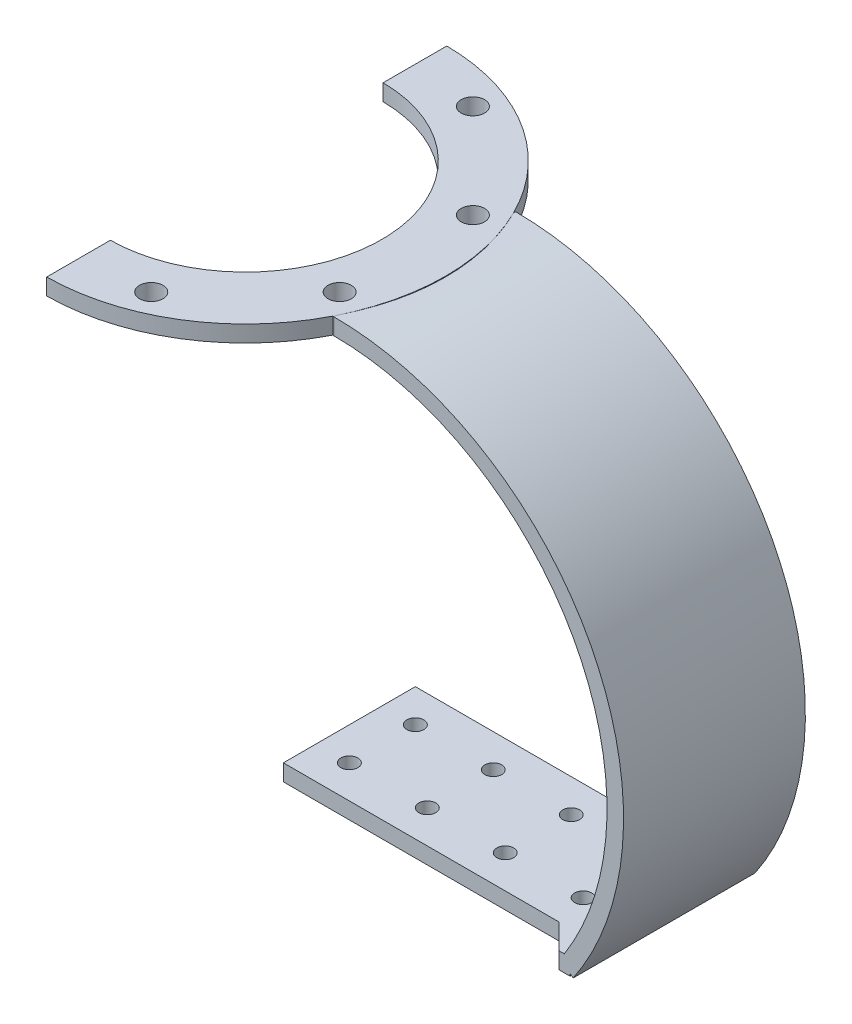
from build123d import *

# Parameters (mm, degrees)
SKETCH2_R               = 2.25
BOSS_EXTRUDE1_DEPTH     = 3.175
SKETCH1_W               = 2.16
SKETCH1_H               = 4.8
SKETCH1_H_2             = 25.4
SKETCH1_W_2             = 57.84
SKETCH1_R               = 1.63
BOSS_EXTRUDE2_DEPTH     = 3.175
TOP_CONNECTION_SKETCH_W = 35
TOP_CONNECTION_SKETCH_H = 3.175
CHAMFER1_SIZE           = 4.8
CHAMFER2_SIZE           = 0.41
CHAMFER2_SIZE_2         = 0.434896144


# Some blends are built 0.0001 mm under size
with BuildPart() as part:
    # Sketch2 → Boss-Extrude1 (new body)
    with BuildSketch(Plane(origin=(0, 87.18, 0), x_dir=(1, 0, 0), z_dir=(0, 1, 0))):
        with BuildLine():
            ThreePointArc((38.5, 0), (27.3118564, 27.135078773), (0.25, 38.499188303))
            Line((0.25, 38.499188303), (0.25, 26.248809497))
            ThreePointArc((0.25, 26.248809497), (18.649731902, 18.472953202), (26.25, 0))
            ThreePointArc((26.25, 0), (18.649731902, -18.472953202), (0.25, -26.248809497))
            Line((0.25, -26.248809497), (0.25, -38.499188303))
            ThreePointArc((0.25, -38.499188303), (27.3118564, -27.135078773), (38.5, 0))
        make_face()
        with Locations(Location((12.819894984, -30.949964339, 0), (0, 0, 270))):
            Circle(SKETCH2_R, mode=Mode.SUBTRACT)
        with Locations(Location((30.949964339, -12.819894984, 0), (0, 0, 270))):
            Circle(SKETCH2_R, mode=Mode.SUBTRACT)
        with Locations(Location((30.949964339, 12.819894984, 0), (0, 0, 270))):
            Circle(SKETCH2_R, mode=Mode.SUBTRACT)
        with Locations(Location((12.819894984, 30.949964339, 0), (0, 0, 270))):
            Circle(SKETCH2_R, mode=Mode.SUBTRACT)
    extrude(amount=-BOSS_EXTRUDE1_DEPTH)



with BuildPart() as body_2:
    # Sketch1 → Boss-Extrude2 (new body)
    # profile 1 of 4: a face of its own
    with BuildSketch(Plane(origin=(0, 0, 0), x_dir=(1, 0, 0), z_dir=(0, 1, 0))):
        with Locations((78.92, 15.1)):
            Rectangle(SKETCH1_W, SKETCH1_H)
    # profile 2 of 4: a face of its own
    with BuildSketch(Plane(origin=(0, 0, 0), x_dir=(1, 0, 0), z_dir=(0, 1, 0))):
        with Locations((78.92, 0)):
            Rectangle(SKETCH1_W, SKETCH1_H_2)
    # profile 3 of 4: a face of its own
    with BuildSketch(Plane(origin=(0, 0, 0), x_dir=(1, 0, 0), z_dir=(0, 1, 0))):
        with Locations((48.92, 0)):
            Rectangle(SKETCH1_W_2, SKETCH1_H_2)
        with Locations(Location((26.35, -6.35, 0), (0, 0, 270))):
            Circle(SKETCH1_R, mode=Mode.SUBTRACT)
        with Locations(Location((41.35, -6.35, 0), (0, 0, 270))):
            Circle(SKETCH1_R, mode=Mode.SUBTRACT)
        with Locations(Location((56.35, -6.35, 0), (0, 0, 270))):
            Circle(SKETCH1_R, mode=Mode.SUBTRACT)
        with Locations(Location((71.35, -6.35, 0), (0, 0, 270))):
            Circle(SKETCH1_R, mode=Mode.SUBTRACT)
        with Locations(Location((26.35, 6.35, 0), (0, 0, 270))):
            Circle(SKETCH1_R, mode=Mode.SUBTRACT)
        with Locations(Location((41.35, 6.35, 0), (0, 0, 270))):
            Circle(SKETCH1_R, mode=Mode.SUBTRACT)
        with Locations(Location((56.35, 6.35, 0), (0, 0, 270))):
            Circle(SKETCH1_R, mode=Mode.SUBTRACT)
        with Locations(Location((71.35, 6.35, 0), (0, 0, 270))):
            Circle(SKETCH1_R, mode=Mode.SUBTRACT)
    # profile 4 of 4: a face of its own
    with BuildSketch(Plane(origin=(0, 0, 0), x_dir=(1, 0, 0), z_dir=(0, 1, 0))):
        with Locations((78.92, -15.1)):
            Rectangle(SKETCH1_W, SKETCH1_H)
    extrude(amount=BOSS_EXTRUDE2_DEPTH)


with BuildPart() as part_1:
    add(part.part)

    add(body_2.part)  # Sweep2 merges body 2
    # Sweep2: sweep along a curve in space
    with BuildLine() as sweep2_path:
        ThreePointArc((80.58, 0, 17.5), (83.80445923, 57.472384507, 17.5), (34.5, 87.18, 17.5))
    # Top_Connection_Sketch → Sweep2 (sweep)
    with BuildSketch(Plane(origin=(34.5, 0, 0), x_dir=(0, 0, -1), z_dir=(1, 0, 0))):
        with Locations((0, 85.5925)):
            Rectangle(TOP_CONNECTION_SKETCH_W, TOP_CONNECTION_SKETCH_H)
    sweep(path=sweep2_path.line)

    # Chamfer1
    chamfer1_edges = [part_1.edges().sort_by_distance(p)[0] for p in [
        (77.84, 1.5875, -12.7),
        (77.84, 1.5875, 12.7),
    ]]
    chamfer(chamfer1_edges, length=CHAMFER1_SIZE - 0.0001)  # a hair under: the kernel refuses the full size

    # Chamfer2
    # the kernel refuses this chamfer: 0.434896144, 0.41 mm, written as the material it adds along each edge
    with BuildSketch(Plane(origin=(34.5, 84.005, 17.088007491), x_dir=(0.04194571569864223, 0, 0.9991198911714894), z_dir=(0, 1, 0))) as chamfer2_piece_1:
        with BuildLine():
            Line((CHAMFER2_SIZE * 0.999119891171, -CHAMFER2_SIZE * 0.0419457156986), (CHAMFER2_SIZE_2 * 0.873966952265, -CHAMFER2_SIZE_2 * 0.485985357052))
            ThreePointArc((CHAMFER2_SIZE_2 * 0.873966952265, -CHAMFER2_SIZE_2 * 0.485985357052), (0.192993875, -0.106615288), (0, 0))
            Line((0, 0), (CHAMFER2_SIZE * 0.999119891171, -CHAMFER2_SIZE * 0.0419457156986))
        make_face()
    extrude(amount=3.175)


solid = part_1.part
